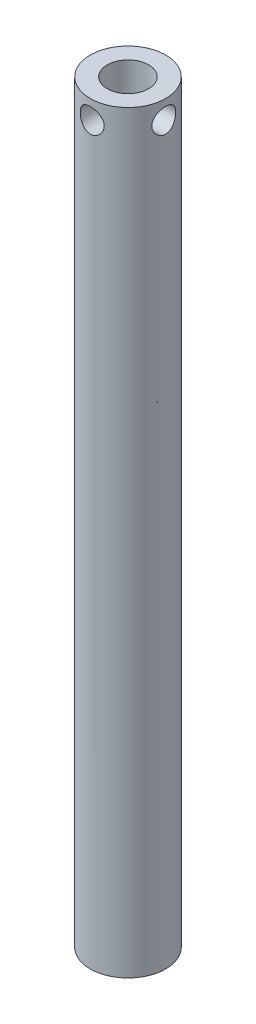
from build123d import *

# Parameters (mm, degrees)
SKETCH1_R                                 = 1
SKETCH1_R_2                               = 0.55
BOSS_EXTRUDE1_DEPTH                       = 20
F_72_0_025_DIAMETER_HOLE1_REACH           = 21.628
F_72_0_025_DIAMETER_HOLE1_BORE_R          = 0.3175
F_72_0_025_DIAMETER_HOLE1_ON_FACE_2_REACH = 21.628
F_72_0_025_DIAMETER_HOLE1_BORE_2_R        = 0.3175
F_54_0_055_DIAMETER_HOLE1_D               = 1.397
F_54_0_055_DIAMETER_HOLE1_DEPTH           = 4
F_54_0_055_DIAMETER_HOLE1_TIP             = 0.419701142


with BuildPart() as part:
    # Sketch1 → Boss-Extrude1 (new body)
    with BuildSketch(Plane(origin=(0, 0, 0), x_dir=(1, 0, 0), z_dir=(0, 1, 0))):
        Circle(SKETCH1_R)
        Circle(SKETCH1_R_2, mode=Mode.SUBTRACT)
    extrude(amount=BOSS_EXTRUDE1_DEPTH)

    # #72 (0.025) Diameter Hole1 bore (on position points) → #72 (0.025) Diameter Hole1 (cut, up to next)
    with BuildSketch(Plane(origin=(1, 19.5, 0), x_dir=(0, 0, 1), z_dir=(1, 0, 0)), mode=Mode.PRIVATE) as f_72_0_025_diameter_hole1_sk1:
        Circle(F_72_0_025_DIAMETER_HOLE1_BORE_R)
    f_72_0_025_diameter_hole1_tool1 = extrude(f_72_0_025_diameter_hole1_sk1.sketch, amount=-F_72_0_025_DIAMETER_HOLE1_REACH, mode=Mode.PRIVATE) & part.part
    add(f_72_0_025_diameter_hole1_tool1.solids().sort_by_distance((1, 19.5, 0))[0], mode=Mode.SUBTRACT)

    # #72 (0.025) Diameter Hole1 bore 2 (on position points) → #72 (0.025) Diameter Hole1 on face 2 (cut, up to next)
    with BuildSketch(Plane(origin=(0, 19.5, 1), x_dir=(1, 0, 0), z_dir=(0, 0, 1)), mode=Mode.PRIVATE) as f_72_0_025_diameter_hole1_on_face_2_sk1:
        Circle(F_72_0_025_DIAMETER_HOLE1_BORE_2_R)
    f_72_0_025_diameter_hole1_on_face_2_tool1 = extrude(f_72_0_025_diameter_hole1_on_face_2_sk1.sketch, amount=-F_72_0_025_DIAMETER_HOLE1_ON_FACE_2_REACH, mode=Mode.PRIVATE) & part.part
    add(f_72_0_025_diameter_hole1_on_face_2_tool1.solids().sort_by_distance((0, 19.5, 1))[0], mode=Mode.SUBTRACT)

    # #54 (0.055) Diameter Hole1
    with Locations(Plane(origin=(0, 0, 0), x_dir=(-1, 0, 0), z_dir=(0, -1, 0))):
        with Locations((0, 0)):
            Hole(F_54_0_055_DIAMETER_HOLE1_D / 2, depth=F_54_0_055_DIAMETER_HOLE1_DEPTH)
            with Locations((0, 0, -(F_54_0_055_DIAMETER_HOLE1_DEPTH + F_54_0_055_DIAMETER_HOLE1_TIP / 2))):  # 118° drill point
                Cone(0, F_54_0_055_DIAMETER_HOLE1_D / 2, F_54_0_055_DIAMETER_HOLE1_TIP, mode=Mode.SUBTRACT)


solid = part.part
